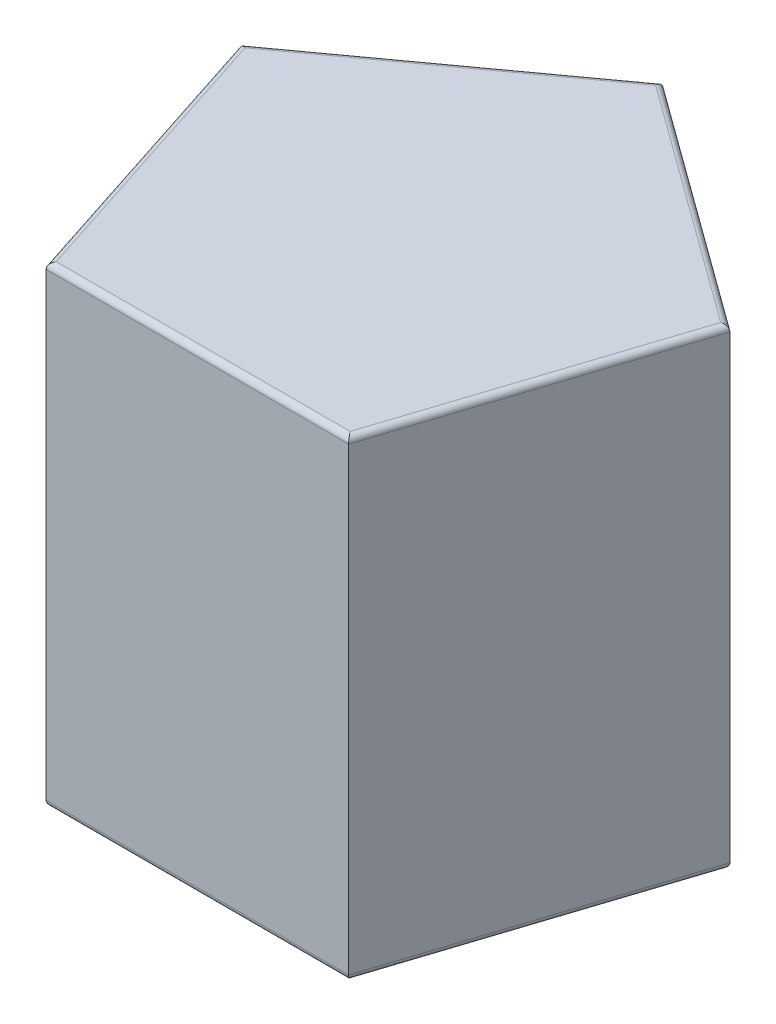
from build123d import *

# Parameters (mm, degrees)
BOSS_EXTRUDE1_DEPTH = 40
FILLET1_R           = 0.5


with BuildPart() as part:
    # Sketch1 → Boss-Extrude1 (new body)
    with BuildSketch(Plane(origin=(0, 0, 0), x_dir=(1, 0, 0), z_dir=(0, 1, 0))):
        Polygon((0, 21.835062978), (-20.766378929, 6.747405533), (-12.834328001, -17.664937022), (12.834328001, -17.664937022), (20.766378929, 6.747405533), align=None)
    extrude(amount=BOSS_EXTRUDE1_DEPTH)

    # Fillet1
    fillet1_edges = [part.edges().sort_by_distance(p)[0] for p in [
        (-10.383189464, 0, -14.291234256),
        (-16.800353465, 0, 5.458765744),
        (0, 0, 17.664937022),
        (16.800353465, 0, 5.458765744),
        (10.383189464, 0, -14.291234256),
        (16.800353465, 40, 5.458765744),
        (0, 40, 17.664937022),
        (-16.800353465, 40, 5.458765744),
        (-10.383189464, 40, -14.291234256),
        (10.383189464, 40, -14.291234256),
    ]]
    fillet(fillet1_edges, radius=FILLET1_R)


solid = part.part
